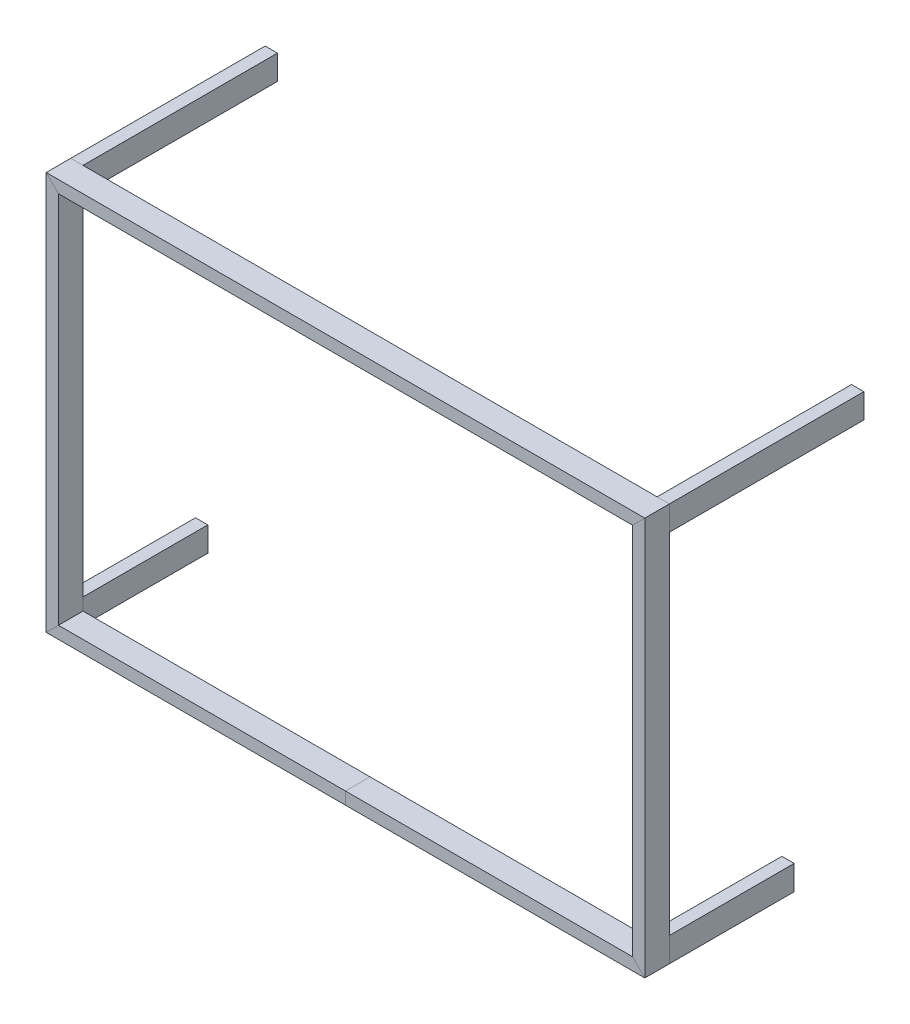
from build123d import *

# Parameters (mm, degrees)
SKETCH19_W            = 50.8
SKETCH19_H            = 25.4
SKETCH20_W            = 25.4
SKETCH20_H            = 50.8
BOSS_EXTRUDE1_DEPTH   = 402.27
BOSS_EXTRUDE1_2_DEPTH = 402.27
SKETCH21_W            = 25.4
SKETCH21_H            = 50.8
BOSS_EXTRUDE2_DEPTH   = 258.12
BOSS_EXTRUDE2_2_DEPTH = 258.12


with BuildPart() as part:
    # Sweep1: sweep along a curve in space
    with BuildLine() as sweep1_path:
        Line((-619.125, 411.92, 0), (619.125, 411.92, 0))
        Line((619.125, 411.92, 0), (619.125, -411.92, 0))
        Line((-619.125, -411.92, 0), (619.125, -411.92, 0))
        Line((-619.125, 411.92, 0), (-619.125, -411.92, 0))
    # Sketch19 → Sweep1 (sweep)
    with BuildSketch(Plane(origin=(0, -411.92, 0), x_dir=(0, 0, -1), z_dir=(1, 0, 0))):
        with Locations((25.4, 12.7)):
            Rectangle(SKETCH19_W, SKETCH19_H)
    sweep(path=sweep1_path.line, transition=Transition.RIGHT)


with BuildPart() as body_2:
    # Sketch20 → Boss-Extrude1 (new body)
    with BuildSketch(Plane(origin=(0, 0, -50.8), x_dir=(-1, 0, 0), z_dir=(0, 0, -1))):
        with Locations((606.425, 386.52)):
            Rectangle(SKETCH20_W, SKETCH20_H)
    extrude(amount=BOSS_EXTRUDE1_DEPTH)


with BuildPart() as body_3:
    # Sketch20 → Boss-Extrude1 2 (new body)
    with BuildSketch(Plane(origin=(0, 0, -50.8), x_dir=(-1, 0, 0), z_dir=(0, 0, -1))):
        with Locations((-606.425, 386.52)):
            Rectangle(SKETCH20_W, SKETCH20_H)
    extrude(amount=BOSS_EXTRUDE1_2_DEPTH)


with BuildPart() as body_4:
    # Sketch21 → Boss-Extrude2 (new body)
    with BuildSketch(Plane(origin=(0, 0, -50.8), x_dir=(-1, 0, 0), z_dir=(0, 0, -1))):
        with Locations((-606.425, -386.52)):
            Rectangle(SKETCH21_W, SKETCH21_H)
    extrude(amount=BOSS_EXTRUDE2_DEPTH)


with BuildPart() as body_5:
    # Sketch21 → Boss-Extrude2 2 (new body)
    with BuildSketch(Plane(origin=(0, 0, -50.8), x_dir=(-1, 0, 0), z_dir=(0, 0, -1))):
        with Locations((606.425, -386.52)):
            Rectangle(SKETCH21_W, SKETCH21_H)
    extrude(amount=BOSS_EXTRUDE2_2_DEPTH)


solid = Compound([part.part, body_2.part, body_3.part, body_4.part, body_5.part])
